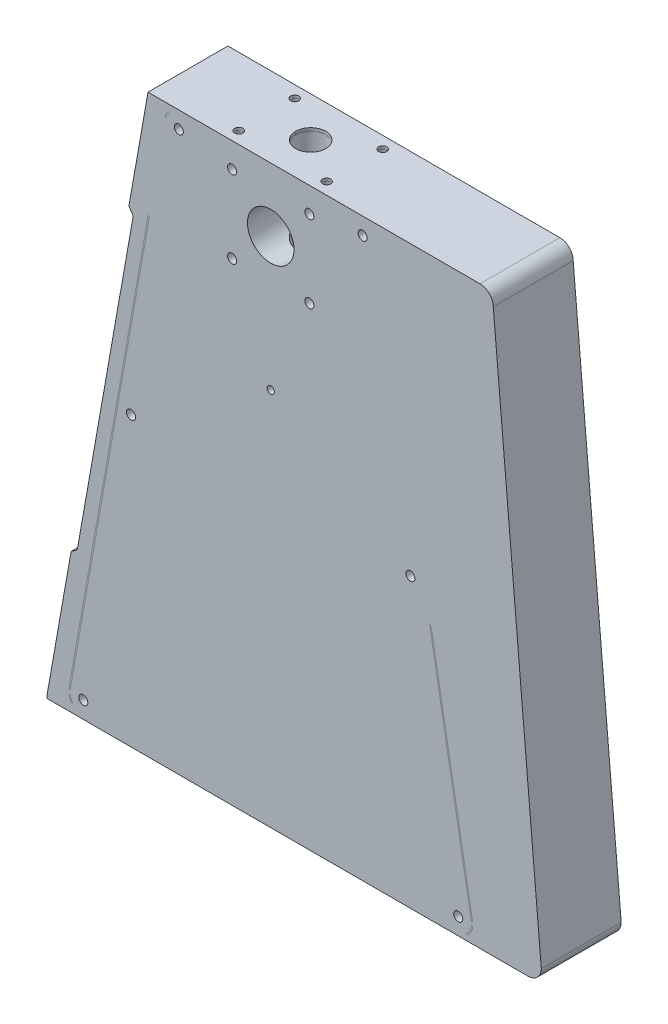
from build123d import *

# Parameters (mm, degrees)
BOSS_EXTRUDE1_OUTLINE_R   = 3.4
BOSS_EXTRUDE1_OUTLINE_R_2 = 2.731026391
BOSS_EXTRUDE1_OUTLINE_R_3 = 17.5
BOSS_EXTRUDE1_DEPTH       = 60
BOSS_EXTRUDE3_DEPTH       = 60
SKETCH8_W                 = 1
SKETCH8_H                 = 89.752073296
CUT_EXTRUDE1_DEPTH        = 500
SKETCH9_W                 = 44.5
SKETCH9_H                 = 44.5
CUT_EXTRUDE2_DEPTH        = 10
SKETCH10_R                = 11.3
CUT_EXTRUDE3_DEPTH        = 400
SKETCH11_R                = 3.1
CUT_EXTRUDE4_DEPTH        = 500
SKETCH14_R                = 11.25
CUT_EXTRUDE5_DEPTH        = 10
SKETCH15_W                = 45
SKETCH15_H                = 45
CUT_EXTRUDE6_DEPTH        = 10


# Read off the part's stored shape, not the designer's step: Boss-Extrude1
with BuildPart() as part:
    # Boss-Extrude1 outline → Boss-Extrude1 (new body)
    with BuildSketch(Plane(origin=(0, 0, 34.708311849), x_dir=(-1, 0, 0), z_dir=(0, 0, -1))):
        with BuildLine():
            Line((363.31183686, -228.772953991), (348.970975483, -147.441887585))
            Line((348.970975483, -147.441887585), (99.700165672, -147.441887585))
            ThreePointArc((99.700165672, -147.441887585), (92.629097861, -150.370819773), (89.700165672, -157.441887585))
            Line((89.700165672, -157.441887585), (53.634334214, -569.6762275))
            ThreePointArc((53.634334214, -569.6762275), (56.563266402, -576.747295312), (63.634334214, -579.6762275))
            Line((63.634334214, -579.6762275), (424.966916863, -579.6762275))
            ThreePointArc((424.966916863, -579.6762275), (424.926132533, -578.515643999), (424.777817765, -577.36385402))
            Line((424.777817765, -577.36385402), (406.723881277, -474.974892244))
            Line((406.723881277, -474.974892244), (403.107969213, -472.44300336))
            ThreePointArc((403.107969213, -472.44300336), (402.298524185, -471.597446052), (401.874275263, -470.50649176))
            Line((401.874275263, -470.50649176), (360.282980849, -234.630539897))
            ThreePointArc((360.282980849, -234.630539897), (360.308516087, -233.460276522), (360.779947976, -232.388866055))
            Line((360.779947976, -232.388866055), (363.31183686, -228.772953991))
        make_face()
        with Locations((116.012971699, -567.034456241)):
            Circle(BOSS_EXTRUDE1_OUTLINE_R, mode=Mode.SUBTRACT)
        with Locations((397.570800945, -567.034456241)):
            Circle(BOSS_EXTRUDE1_OUTLINE_R, mode=Mode.SUBTRACT)
        with Locations((151.8911744, -363.559057542)):
            Circle(BOSS_EXTRUDE1_OUTLINE_R, mode=Mode.SUBTRACT)
        with Locations((227.800508293, -224.075036872)):
            Circle(BOSS_EXTRUDE1_OUTLINE_R, mode=Mode.SUBTRACT)
        with Locations((187.769377101, -160.083658844)):
            Circle(BOSS_EXTRUDE1_OUTLINE_R, mode=Mode.SUBTRACT)
        with Locations((227.800508293, -166.092280815)):
            Circle(BOSS_EXTRUDE1_OUTLINE_R, mode=Mode.SUBTRACT)
        with Locations((256.791886322, -295.083658844)):
            Circle(BOSS_EXTRUDE1_OUTLINE_R_2, mode=Mode.SUBTRACT)
        with Locations((361.692598244, -363.559057542)):
            Circle(BOSS_EXTRUDE1_OUTLINE_R, mode=Mode.SUBTRACT)
        with Locations((285.783264351, -224.075036872)):
            Circle(BOSS_EXTRUDE1_OUTLINE_R, mode=Mode.SUBTRACT)
        with Locations((256.791886322, -195.083658844)):
            Circle(BOSS_EXTRUDE1_OUTLINE_R_3, mode=Mode.SUBTRACT)
        with Locations((285.783264351, -166.092280815)):
            Circle(BOSS_EXTRUDE1_OUTLINE_R, mode=Mode.SUBTRACT)
        with Locations((325.814395543, -160.083658844)):
            Circle(BOSS_EXTRUDE1_OUTLINE_R, mode=Mode.SUBTRACT)
    extrude(amount=BOSS_EXTRUDE1_DEPTH)


with BuildPart() as body_2:
    # Sketch7 → Boss-Extrude3 (new body)
    with BuildSketch(Plane(origin=(0, 0, -25.291688151), x_dir=(-1, 0, 0), z_dir=(0, 0, -1))):
        with BuildLine():
            Line((176.936491818, -158.173528889), (105.180086416, -565.124326287))
            ThreePointArc((105.180086416, -565.124326287), (107.8459394, -574.403281345), (116.802822205, -578.006062148))
            Line((116.802822205, -578.006062148), (398.36065145, -578.006062148))
            ThreePointArc((398.36065145, -578.006062148), (406.245867313, -573.797829918), (408.403686228, -565.124326287))
            Line((408.403686228, -565.124326287), (336.647280826, -158.173528889))
            ThreePointArc((336.647280826, -158.173528889), (332.885059249, -151.657169969), (325.814395543, -149.083658844))
            Line((325.814395543, -149.083658844), (187.769377101, -149.083658844))
            ThreePointArc((187.769377101, -149.083658844), (180.698713395, -151.657169969), (176.936491818, -158.173528889))
        make_face()
        with BuildLine():
            Line((116.012971699, -577.034456241), (398.360792979, -577.003203032))
            ThreePointArc((398.360792979, -577.003203032), (405.479354856, -573.154486881), (407.418878475, -565.297974465))
            Line((407.418878475, -565.297974465), (335.662473073, -158.347177067))
            ThreePointArc((335.662473073, -158.347177067), (332.242271639, -152.423214412), (325.814395543, -150.083658844))
            Line((325.814395543, -150.083658844), (187.769377101, -150.083658844))
            ThreePointArc((187.769377101, -150.083658844), (181.341501005, -152.423214412), (177.921299571, -158.347177067))
            Line((177.921299571, -158.347177067), (106.164894169, -565.297974465))
            ThreePointArc((106.164894169, -565.297974465), (108.352527268, -573.462332338), (116.012971699, -577.034456241))
        make_face(mode=Mode.SUBTRACT)
    extrude(amount=-BOSS_EXTRUDE3_DEPTH)

    # Sketch8 → Cut-Extrude1 (cut)
    with BuildSketch(Plane(origin=(0, -149.083658844, 0), x_dir=(1, 0, 0), z_dir=(0, 1, 0))):
        with Locations((-256.791886322, -4.708311849)):
            Rectangle(SKETCH8_W, SKETCH8_H)
    extrude(amount=-CUT_EXTRUDE1_DEPTH, mode=Mode.SUBTRACT)


with BuildPart() as cut_extrude1_piece_1:
    # of the separate pieces the step leaves, piece 1, a body of its own (cut_extrude1_pieces)
    add(body_2.part.solids().sort_by_distance((-325.814395543, -149.083658844, -25.291688151))[0])


with BuildPart() as cut_extrude1_piece_2:
    # of the separate pieces the step leaves, piece 2, a body of its own (cut_extrude1_pieces)
    add(body_2.part.solids().sort_by_distance((-256.291886322, -149.083658844, -25.291688151))[0])


with BuildPart() as cut_extrude2_tool:
    # Sketch9 → Cut-Extrude2 (new body)
    with BuildSketch(Plane(origin=(-256.791886322, -578.006062148, 332.594784159), x_dir=(1, 0, 0), z_dir=(0, -1, 0))):
        with Locations((-82.560015644, -327.63647231)):
            Rectangle(SKETCH9_W, SKETCH9_H)
    cut_extrude2 = extrude(amount=-CUT_EXTRUDE2_DEPTH)


with BuildPart() as part_1:
    add(part.part)

    # Cut-Extrude2: cut by cut_extrude2_tool
    add(cut_extrude2_tool.part, mode=Mode.SUBTRACT)


with BuildPart() as cut_extrude1_piece_1_1:
    add(cut_extrude1_piece_1.part)

    # Cut-Extrude2: cut by cut_extrude2_tool
    add(cut_extrude2_tool.part, mode=Mode.SUBTRACT)


with BuildPart() as mirror1_tool:
    # Mirror1: Cut-Extrude2 across plane
    add(cut_extrude2.mirror(Plane.ZY.offset(256.791886322)))


with BuildPart() as part_2:
    add(part_1.part)

    # Mirror1: cut by mirror1_tool
    add(mirror1_tool.part, mode=Mode.SUBTRACT)


with BuildPart() as cut_extrude1_piece_2_1:
    add(cut_extrude1_piece_2.part)

    # Mirror1: cut by mirror1_tool
    add(mirror1_tool.part, mode=Mode.SUBTRACT)


with BuildPart() as cut_extrude3_tool:
    # Sketch10 → Cut-Extrude3 (new body)
    with BuildSketch(Plane(origin=(-256.791886322, -546.520608145, 332.594784159), x_dir=(1, 0, 0), z_dir=(0, -1, 0))):
        with Locations(Location((0, -327.88647231, 0), (0, 0, 270))):
            Circle(SKETCH10_R)
    extrude(amount=-CUT_EXTRUDE3_DEPTH)


with BuildPart() as part_3:
    add(part_2.part)

    # Cut-Extrude3: cut by cut_extrude3_tool
    add(cut_extrude3_tool.part, mode=Mode.SUBTRACT)


with BuildPart() as cut_extrude1_piece_1_2:
    add(cut_extrude1_piece_1_1.part)

    # Cut-Extrude3: cut by cut_extrude3_tool
    add(cut_extrude3_tool.part, mode=Mode.SUBTRACT)


with BuildPart() as cut_extrude1_piece_2_2:
    add(cut_extrude1_piece_2_1.part)

    # Cut-Extrude3: cut by cut_extrude3_tool
    add(cut_extrude3_tool.part, mode=Mode.SUBTRACT)


with BuildPart() as cut_extrude4_tool:
    # Sketch11 → Cut-Extrude4 (new body)
    with BuildSketch(Plane(origin=(-256.791886322, -547.520608145, 332.594784159), x_dir=(1, 0, 0), z_dir=(0, -1, 0))):
        with Locations(Location((-33, -348.88647231, 0), (0, 0, 90))):
            Circle(SKETCH11_R)
        with Locations(Location((33, -348.88647231, 0), (0, 0, 90))):
            Circle(SKETCH11_R)
        with Locations(Location((33, -306.88647231, 0), (0, 0, 90))):
            Circle(SKETCH11_R)
        with Locations(Location((-33, -306.88647231, 0), (0, 0, 90))):
            Circle(SKETCH11_R)
    extrude(amount=-CUT_EXTRUDE4_DEPTH)


with BuildPart() as part_4:
    add(part_3.part)

    # Cut-Extrude4: cut by cut_extrude4_tool
    add(cut_extrude4_tool.part, mode=Mode.SUBTRACT)


with BuildPart() as cut_extrude1_piece_1_3:
    add(cut_extrude1_piece_1_2.part)

    # Cut-Extrude4: cut by cut_extrude4_tool
    add(cut_extrude4_tool.part, mode=Mode.SUBTRACT)


with BuildPart() as cut_extrude1_piece_2_3:
    add(cut_extrude1_piece_2_2.part)

    # Cut-Extrude4: cut by cut_extrude4_tool
    add(cut_extrude4_tool.part, mode=Mode.SUBTRACT)


with BuildPart() as cut_extrude5_tool:
    # Sketch14 → Cut-Extrude5 (new body)
    with BuildSketch(Plane(origin=(-256.791886322, -578.006062148, 332.594784159), x_dir=(1, 0, 0), z_dir=(0, -1, 0))):
        with Locations((0, -327.88647231)):
            Circle(SKETCH14_R)
    extrude(amount=-CUT_EXTRUDE5_DEPTH)


with BuildPart() as part_5:
    add(part_4.part)

    # Cut-Extrude5: cut by cut_extrude5_tool
    add(cut_extrude5_tool.part, mode=Mode.SUBTRACT)


with BuildPart() as cut_extrude1_piece_1_4:
    add(cut_extrude1_piece_1_3.part)

    # Cut-Extrude5: cut by cut_extrude5_tool
    add(cut_extrude5_tool.part, mode=Mode.SUBTRACT)


with BuildPart() as cut_extrude1_piece_2_4:
    add(cut_extrude1_piece_2_3.part)

    # Cut-Extrude5: cut by cut_extrude5_tool
    add(cut_extrude5_tool.part, mode=Mode.SUBTRACT)


with BuildPart() as cut_extrude6_tool:
    # Sketch15 → Cut-Extrude6 (new body)
    with BuildSketch(Plane(origin=(-256.791886322, -578.006062148, 332.594784159), x_dir=(1, 0, 0), z_dir=(0, -1, 0))):
        with Locations((-82.810015644, -327.88647231)):
            Rectangle(SKETCH15_W, SKETCH15_H)
    extrude(amount=-CUT_EXTRUDE6_DEPTH)


with BuildPart() as part_6:
    add(part_5.part)

    # Cut-Extrude6: cut by cut_extrude6_tool
    add(cut_extrude6_tool.part, mode=Mode.SUBTRACT)


with BuildPart() as cut_extrude1_piece_1_5:
    add(cut_extrude1_piece_1_4.part)

    # Cut-Extrude6: cut by cut_extrude6_tool
    add(cut_extrude6_tool.part, mode=Mode.SUBTRACT)


solid = Compound([cut_extrude1_piece_2_4.part, part_6.part, cut_extrude1_piece_1_5.part])
